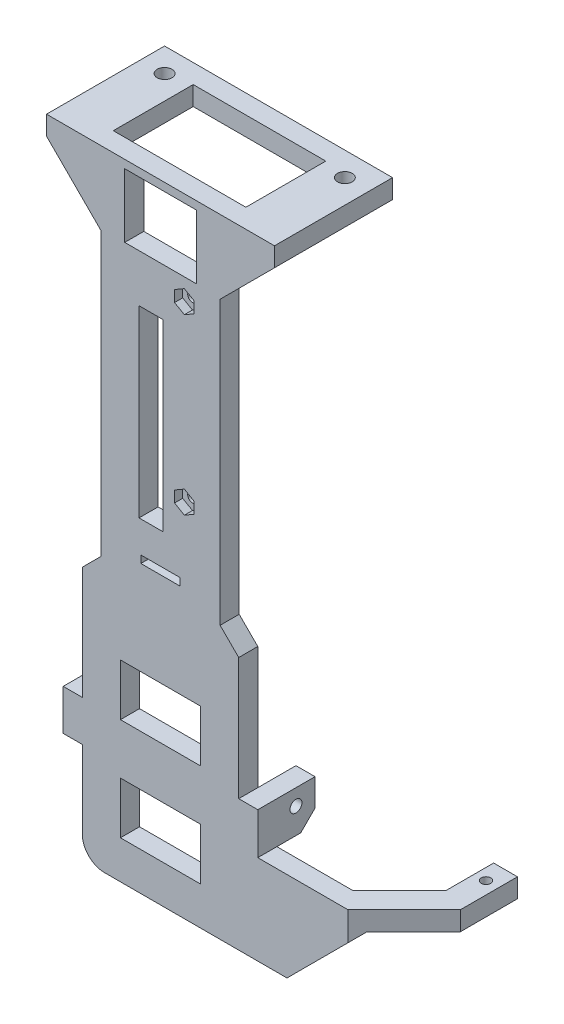
from build123d import *

# Parameters (mm, degrees)
EXTRUDE_1_DEPTH     = 4
SKETCH_2_W          = 15
SKETCH_2_H          = 13.3866
CUT_EXTRUDE_1_DEPTH = 121.93395925
SKETCH_3_W          = 10
SKETCH_3_H          = 10
SKETCH_3_R          = 1.55
SKETCH_3_H_2        = 14.755
EXTRUDE_2_DEPTH     = 4
EXTRUDE_3_DEPTH     = 4
EXTRUDE_4_DEPTH     = 4
SKETCH_7_W          = 27.8
SKETCH_7_H          = 4
EXTRUDE_5_DEPTH     = 4
EXTRUDE_START       = -4
EXTRUDE_6_DEPTH     = 4
SKETCH_11_W         = 16.8
SKETCH_11_H         = 10.85
CUT_EXTRUDE_2_DEPTH = 133.52791749
CHAMFER_1_SIZE      = 2
CHAMFER_2_SIZE      = 2
SKETCH_12_W         = 12
SKETCH_12_H         = 8.55
SKETCH_12_R         = 1.25
EXTRUDE_7_DEPTH     = 4
EXTRUDE_START_2     = 4
SKETCH_13_R         = 1.25
SKETCH_13_W         = 4
SKETCH_13_H         = 8.709663749
EXTRUDE_8_DEPTH     = 4
SKETCH_14_R         = 1
CUT_EXTRUDE_3_DEPTH = 132.839329922
SKETCH_15_R         = 0.9
EXTRUDE_9_DEPTH     = 1
FILLET_1_R          = 0.9
CUT_EXTRUDE_START   = -1.7
SKETCH_16_R         = 1
CUT_EXTRUDE_4_DEPTH = 1.7
CUT_EXTRUDE_5_DEPTH = 132.839329922
SKETCH_19_W         = 5
SKETCH_19_H         = 38.5268
SKETCH_19_W_2       = 8.236887868
SKETCH_19_H_2       = 1.55
CUT_EXTRUDE_6_DEPTH = 132.839329922


with BuildPart() as part:
    # 草图1 → 凸台-拉伸1 (new body)
    with BuildSketch(Plane.XY):
        with BuildLine():
            Line((-16.4, -7.25), (-16.4, 119.75))
            Line((-16.4, 119.75), (16.4, 119.75))
            Line((16.4, 119.75), (16.4, -7.25))
            ThreePointArc((16.4, -7.25), (15.038046533, -10.538046533), (11.75, -11.9))
            Line((11.75, -11.9), (-11.75, -11.9))
            ThreePointArc((-11.75, -11.9), (-15.038046533, -10.538046533), (-16.4, -7.25))
        make_face()
    extrude(amount=EXTRUDE_1_DEPTH)

    # 草图2 → 切除-拉伸1 (cut, through all)
    with BuildSketch(Plane(origin=(0, 0, 0), x_dir=(-1, 0, 0), z_dir=(0, 0, -1))):
        with Locations((0, 111.3567)):
            Rectangle(SKETCH_2_W, SKETCH_2_H)
    extrude(amount=-CUT_EXTRUDE_1_DEPTH, mode=Mode.SUBTRACT)

    # 草图3 → 凸台-拉伸2 (add)
    # profile 1 of 2: a face of its own
    with BuildSketch(Plane(origin=(0, 119.75, 0), x_dir=(1, 0, 0), z_dir=(0, 1, 0))):
        with Locations((-18.9, 15.755)):
            Rectangle(SKETCH_3_W, SKETCH_3_H)
        with Locations(Location((-18.9, 15.755, 0), (0, 0, 270))):
            Circle(SKETCH_3_R, mode=Mode.SUBTRACT)
    # profile 2 of 2: a face of its own
    with BuildSketch(Plane(origin=(0, 119.75, 0), x_dir=(1, 0, 0), z_dir=(0, 1, 0))):
        with Locations((-18.9, 3.3775)):
            Rectangle(SKETCH_3_W, SKETCH_3_H_2)
    extrude_2 = extrude(amount=-EXTRUDE_2_DEPTH)

    # 镜向1: 凸台-拉伸2 across plane
    add(extrude_2.mirror(Plane(origin=(0, 0, 0), x_dir=(0, 0, 1), z_dir=(1, 0, 0))))

    # 草图6 → 凸台-拉伸4 (add)
    with BuildSketch(Plane.XY.offset(4)):
        Polygon((-16.4, 115.75), (-23.9, 115.75), (-16.4, 108.25), align=None)
        Polygon((16.4, 115.75), (16.4, 108.25), (23.9, 115.75), align=None)
    extrude(amount=-EXTRUDE_4_DEPTH)

    # 草图7 → 凸台-拉伸5 (add)
    with BuildSketch(Plane(origin=(0, 119.75, 0), x_dir=(1, 0, 0), z_dir=(0, 1, 0))):
        with Locations((0, 18.755)):
            Rectangle(SKETCH_7_W, SKETCH_7_H)
    extrude(amount=-EXTRUDE_5_DEPTH)



with BuildPart() as body_2:
    # 草图5 → 凸台-拉伸3 (new body)
    with BuildSketch(Plane(origin=(0, 2.890336251, 0), x_dir=(1, 0, 0), z_dir=(0, 1, 0))):
        Polygon((50.795757056, 9.855), (46.095757056, 9.855), (32.240757056, -4), (39.311824868, -4), (51.095757056, 7.783932188), (51.095757056, 9.855), align=None)
        with BuildLine():
            Line((50.795757056, 19.755), (46.095757056, 19.755))
            Line((46.095757056, 19.755), (46.095757056, 9.855))
            Line((46.095757056, 9.855), (50.795757056, 9.855))
            Line((50.795757056, 9.855), (50.795757056, 15.105))
            Line((50.795757056, 15.105), (49.255691264, 15.105))
            ThreePointArc((49.255691264, 15.105), (47.495757056, 15.755), (49.255691264, 16.405))
            Line((49.255691264, 16.405), (50.795757056, 16.405))
            Line((50.795757056, 16.405), (50.795757056, 19.755))
        make_face()
        with BuildLine():
            Line((51.095757056, 19.755), (50.795757056, 19.755))
            Line((50.795757056, 19.755), (50.795757056, 16.405))
            Line((50.795757056, 16.405), (49.255691264, 16.405))
            ThreePointArc((49.255691264, 16.405), (49.433822674, 16.10145764), (49.495757056, 15.755))
            ThreePointArc((49.495757056, 15.755), (49.433822674, 15.40854236), (49.255691264, 15.105))
            Line((49.255691264, 15.105), (50.795757056, 15.105))
            Line((50.795757056, 15.105), (50.795757056, 9.855))
            Line((50.795757056, 9.855), (51.095757056, 9.855))
            Line((51.095757056, 9.855), (51.095757056, 19.755))
        make_face()
    extrude(amount=EXTRUDE_3_DEPTH)


with BuildPart() as part_1:
    add(part.part)

    add(body_2.part)  # 凸台-拉伸6 merges body 2
    # 草图8 → 凸台-拉伸6 (add)
    with BuildSketch(Plane.XY.offset(4).offset(EXTRUDE_START)):
        with BuildLine():
            Line((26.521488617, -11.9), (39.311824868, 0.890336251))
            Line((39.311824868, 0.890336251), (39.311824868, 6.890336251))
            Line((39.311824868, 6.890336251), (16.4, 6.890336251))
            Line((16.4, 6.890336251), (16.4, -7.25))
            ThreePointArc((16.4, -7.25), (15.038046533, -10.538046533), (11.75, -11.9))
            Line((11.75, -11.9), (26.521488617, -11.9))
        make_face()
    extrude(amount=EXTRUDE_6_DEPTH)

    # 草图11 → 切除-拉伸2 (cut, through all)
    with BuildSketch(Plane.XY.offset(4)):
        with Locations((0, 1.525)):
            Rectangle(SKETCH_11_W, SKETCH_11_H)
        with Locations((0, 22.975)):
            Rectangle(SKETCH_11_W, SKETCH_11_H)
    extrude(amount=-CUT_EXTRUDE_2_DEPTH, mode=Mode.SUBTRACT)

    # 倒角1
    chamfer_1_edges = [part_1.edges().sort_by_distance(p)[0] for p in [
        (39.311824868, 2.890336251, 2),
    ]]
    chamfer(chamfer_1_edges, length=CHAMFER_1_SIZE - 0.0001)  # a hair under: the kernel refuses the full size

    # 倒角2
    chamfer_2_edges = [part_1.edges().sort_by_distance(p)[0] for p in [
        (38.776240962, 2.890336251, 0),
    ]]
    chamfer(chamfer_2_edges, length=CHAMFER_2_SIZE - 0.0001)  # a hair under: the kernel refuses the full size

    # 草图12 → 凸台-拉伸7 (add)
    with BuildSketch(Plane.ZY.offset(16.4)):
        with Locations((-2, 13.325)):
            Rectangle(SKETCH_12_W, SKETCH_12_H)
        with Locations((-4, 12.25)):
            Circle(SKETCH_12_R, mode=Mode.SUBTRACT)
    extrude(amount=EXTRUDE_7_DEPTH)

    # 草图13 → 凸台-拉伸8 (add)
    # profile 1 of 2: a face of its own
    with BuildSketch(Plane(origin=(16.4, 0, 0), x_dir=(0, 0, -1), z_dir=(1, 0, 0)).offset(EXTRUDE_START_2)):
        Polygon((8, 9.890336251), (8, 15.6), (0, 15.6), (0, 6.890336251), (5, 6.890336251), align=None)
        with Locations(Location((4, 12.25, 0), (0, 0, 180))):
            Circle(SKETCH_13_R, mode=Mode.SUBTRACT)
    # profile 2 of 2: a face of its own
    with BuildSketch(Plane(origin=(16.4, 0, 0), x_dir=(0, 0, -1), z_dir=(1, 0, 0)).offset(EXTRUDE_START_2)):
        with Locations((-2, 11.245168126)):
            Rectangle(SKETCH_13_W, SKETCH_13_H)
    extrude(amount=-EXTRUDE_8_DEPTH)

    # 草图14 → 切除-拉伸3 (cut, through all)
    with BuildSketch(Plane(origin=(0, 0, 0), x_dir=(-1, 0, 0), z_dir=(0, 0, -1))):
        with Locations((-5, 63.75)):
            Circle(SKETCH_14_R)
        with Locations((-5, 100.15)):
            Circle(SKETCH_14_R)
    extrude(amount=-CUT_EXTRUDE_3_DEPTH, mode=Mode.SUBTRACT)

    # 草图15 → 凸台-拉伸9 (add)
    with BuildSketch(Plane(origin=(0, 0, 0), x_dir=(-1, 0, 0), z_dir=(0, 0, -1))):
        with Locations(Location((-5, 95.5, 0), (0, 0, 180))):
            Circle(SKETCH_15_R)
        with Locations(Location((-5, 59.13, 0), (0, 0, 180))):
            Circle(SKETCH_15_R)
    extrude(amount=EXTRUDE_9_DEPTH)

    # 圆角1
    fillet_1_edges = [part_1.edges().sort_by_distance(p)[0] for p in [
        (4.1, 95.5, -1),
        (4.1, 59.13, -1),
    ]]
    fillet(fillet_1_edges, radius=FILLET_1_R)

    # 草图16 → 切除-拉伸4 (cut)
    # profile 1 of 2: a face of its own
    with BuildSketch(Plane.XY.offset(4).offset(CUT_EXTRUDE_START)):
        Polygon((7.05, 62.566431948), (7.05, 64.933568052), (5, 66.117136104), (2.95, 64.933568052), (2.95, 62.566431948), (5, 61.382863896), align=None)
        with Locations(Location((5, 63.75, 0), (0, 0, 180))):
            Circle(SKETCH_16_R, mode=Mode.SUBTRACT)
    # profile 2 of 2: a face of its own
    with BuildSketch(Plane.XY.offset(4).offset(CUT_EXTRUDE_START)):
        Polygon((2.95, 98.966431948), (5, 97.782863896), (7.05, 98.966431948), (7.05, 101.333568052), (5, 102.517136104), (2.95, 101.333568052), align=None)
        with Locations(Location((5, 100.15, 0), (0, 0, 180))):
            Circle(SKETCH_16_R, mode=Mode.SUBTRACT)
    extrude(amount=CUT_EXTRUDE_4_DEPTH, mode=Mode.SUBTRACT)

    # 草图17 → 切除-拉伸5 (cut, symmetric)
    with BuildSketch(Plane(origin=(0, 0, 0), x_dir=(-1, 0, 0), z_dir=(0, 0, -1))):
        Polygon((-12.5, 104.35), (-16.4, 108.25), (-16.4, 41.2366), (-12.5, 45.1366), align=None)
    cut_extrude_5 = extrude(amount=CUT_EXTRUDE_5_DEPTH, both=True, mode=Mode.SUBTRACT)

    # 镜向2: 切除-拉伸5 across plane
    add(cut_extrude_5.mirror(Plane(origin=(0, 0, 0), x_dir=(0, 0, 1), z_dir=(1, 0, 0))), mode=Mode.SUBTRACT)

    # 草图19 → 切除-拉伸6 (cut, through all)
    with BuildSketch(Plane(origin=(0, 0, 0), x_dir=(-1, 0, 0), z_dir=(0, 0, -1))):
        with Locations((2, 75.4)):
            Rectangle(SKETCH_19_W, SKETCH_19_H)
        with Locations((0, 48.825)):
            Rectangle(SKETCH_19_W_2, SKETCH_19_H_2)
    extrude(amount=-CUT_EXTRUDE_6_DEPTH, mode=Mode.SUBTRACT)


solid = part_1.part
